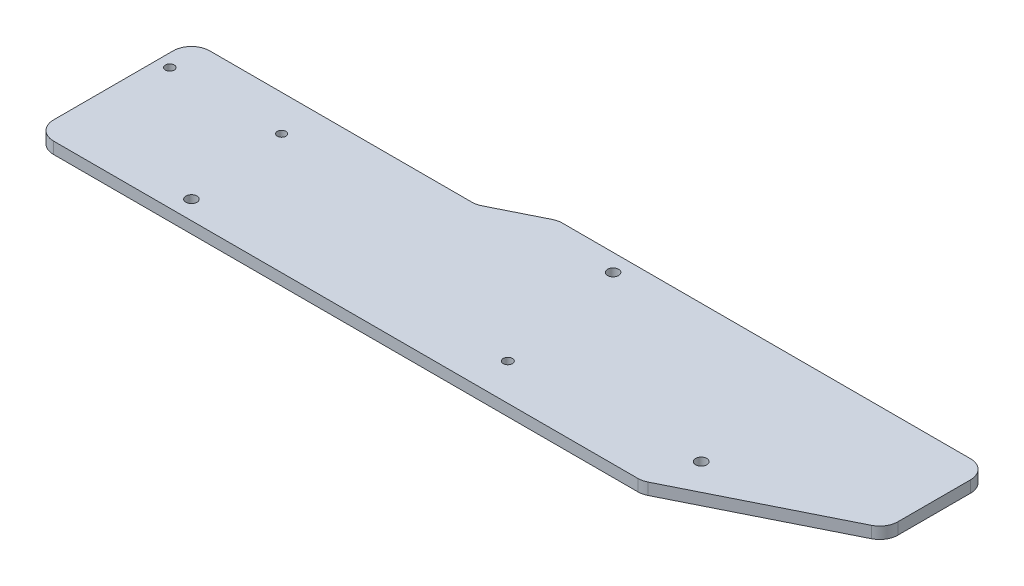
from build123d import *

# Parameters (mm, degrees)
SKETCH1_W           = 210
SKETCH1_H           = 50
SKETCH1_R           = 1.211665018
SKETCH1_R_2         = 1.165617118
SKETCH1_R_3         = 1.5
SKETCH1_R_4         = 1.25
SKETCH1_R_5         = 1.517273905
BOSS_EXTRUDE1_DEPTH = 3.175
CUT_EXTRUDE7_DEPTH  = 10
FILLET3_R           = 5


with BuildPart() as part:
    # Sketch1 → Boss-Extrude1 (new body)
    with BuildSketch(Plane(origin=(0, 0, 0), x_dir=(1, 0, 0), z_dir=(0, 1, 0))):
        with Locations((105, -25)):
            Rectangle(SKETCH1_W, SKETCH1_H)
        with Locations((3.489526233, -16.787661112)):
            Circle(SKETCH1_R, mode=Mode.SUBTRACT)
        with Locations((34.37258772, -17.194005245)):
            Circle(SKETCH1_R_2, mode=Mode.SUBTRACT)
        with Locations((37.520749958, -44.921198121)):
            Circle(SKETCH1_R_3, mode=Mode.SUBTRACT)
        with Locations((118.879039361, -40.017685043)):
            Circle(SKETCH1_R_4, mode=Mode.SUBTRACT)
        with Locations((112.302052499, -4.739260115)):
            Circle(SKETCH1_R_3, mode=Mode.SUBTRACT)
        with Locations((168.975233936, -37.403209633)):
            Circle(SKETCH1_R_5, mode=Mode.SUBTRACT)
    extrude(amount=BOSS_EXTRUDE1_DEPTH)

    # Sketch10 → Cut-Extrude7 (cut)
    with BuildSketch(Plane(origin=(0, 3.175, 0), x_dir=(1, 0, 0), z_dir=(0, 1, 0))):
        Polygon((210, -27.859435908), (165.502877994, -50), (210, -50), align=None)
        Polygon((92.532613397, 0), (77.65477062, -7.402812063), (0, -7.402812063), (0, 0), align=None)
    extrude(amount=-CUT_EXTRUDE7_DEPTH, mode=Mode.SUBTRACT)

    # Fillet3
    fillet3_edges = [part.edges().sort_by_distance(p)[0] for p in [
        (0, 1.5875, 50),
        (0, 1.5875, 7.402812063),
        (77.65477062, 1.5875, 7.402812063),
        (92.532613397, 1.5875, 0),
        (210, 1.5875, 0),
        (210, 1.5875, 27.859435908),
        (165.502877994, 1.5875, 50),
    ]]
    fillet(fillet3_edges, radius=FILLET3_R)


solid = part.part
